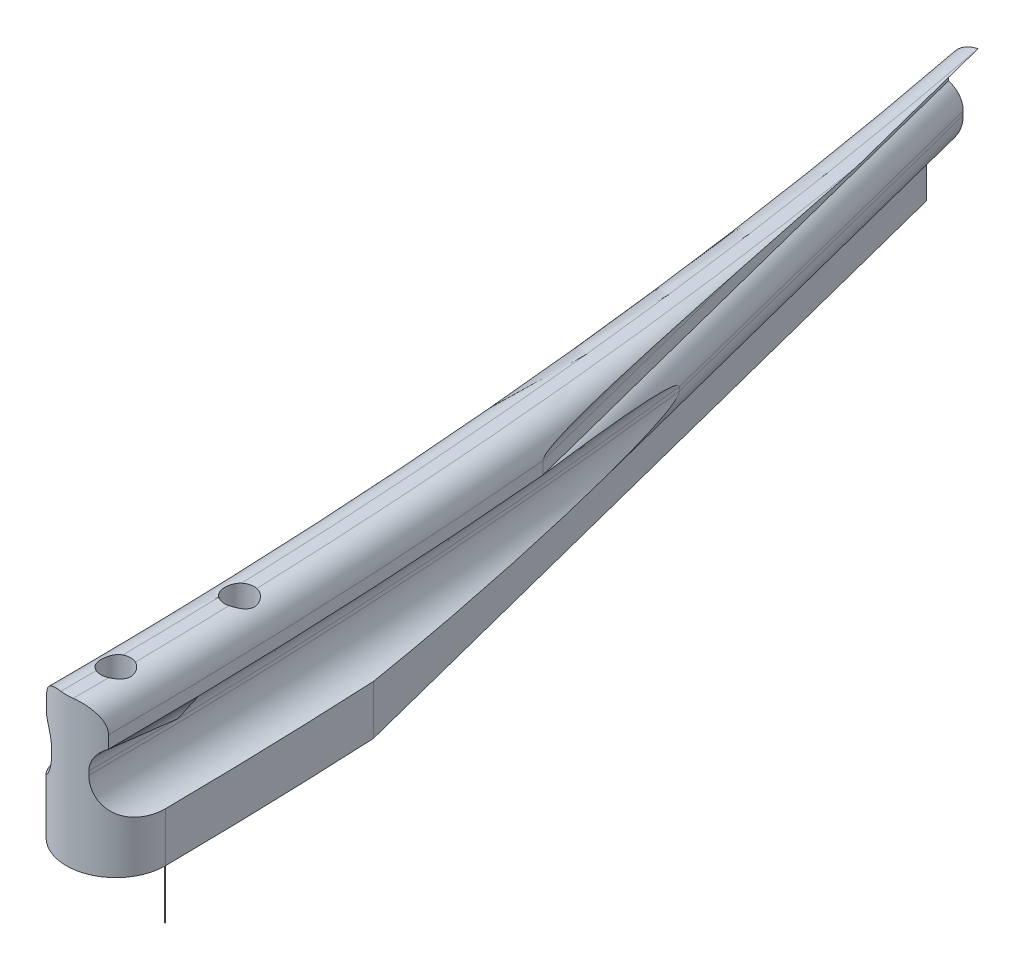
from build123d import *
from OCP.BRepAlgoAPI import BRepAlgoAPI_Cut
from OCP.TopTools import TopTools_ListOfShape

# Parameters (mm, degrees)
SKETCH_1_W                = 4
SKETCH_1_H                = 21.3823
SKETCH_1_H_2              = 8
EXTRUDE_1_DEPTH           = 4
SKETCH_1_7_W              = 44.5
SKETCH_1_7_H              = 8
EXTRUDE_2_DEPTH           = 3.5
SKETCH_2_W                = 18.5
SKETCH_2_H                = 1.5
CUT_EXTRUDE_1_DEPTH       = 38.072659107
SKETCH_2_3_W              = 2.5
SKETCH_2_3_H              = 1.5
EXTRUDE_4_DEPTH           = 29.3823
FILLET_1_R                = 1
FILLET_2_R                = 1.5
FILLET_3_R                = 1
REVOLVE_2_ANGLE           = 30
CUT_EXTRUDE_5_DEPTH       = 112.412872349
CUT_EXTRUDE_START         = -9
CUT_EXTRUDE_6_DEPTH       = 10
SKETCH_9_W                = 32.627713819
SKETCH_9_H                = 2
CUT_EXTRUDE_7_DEPTH       = 126.089275919
CUT_EXTRUDE_8_DEPTH       = 126.089275919
CUT_EXTRUDE_START_2       = -49.267691206
CUT_EXTRUDE_9_DEPTH       = 49.267691206
SKETCH_16_R               = 0.6
CUT_EXTRUDE_10_DEPTH      = 69.120571654
SKETCH_18_R               = 0.6
CUT_EXTRUDE_11_DEPTH      = 69.120571654
CUT_EXTRUDE_12_DEPTH      = 69.325780514
CUT_EXTRUDE_13_DEPTH      = 65.449078785
CUT_EXTRUDE_14_DEPTH      = 45.022808236
CUT_EXTRUDE_14_DEPTH_BACK = 45.022808236


with BuildPart() as part:
    # 草图1 → 凸台-拉伸1 (new body)
    with BuildSketch(Plane(origin=(0, 0, 0), x_dir=(1, 0, 0), z_dir=(0, 1, 0))):
        with Locations((-15.75, -4)):
            Rectangle(SKETCH_1_W, SKETCH_1_H)
        with Locations((15.75, -4)):
            Rectangle(SKETCH_1_W, SKETCH_1_H)
        with Locations((15.75, 10.69115)):
            Rectangle(SKETCH_1_W, SKETCH_1_H_2)
        with Locations((-15.75, 10.69115)):
            Rectangle(SKETCH_1_W, SKETCH_1_H_2)
    extrude(amount=EXTRUDE_1_DEPTH)

    # 草图1<7> → 凸台-拉伸2 (add)
    with BuildSketch(Plane(origin=(0, 0, 0), x_dir=(1, 0, 0), z_dir=(0, 1, 0))):
        with Locations((0, 10.69115)):
            Rectangle(SKETCH_1_7_W, SKETCH_1_7_H)
    extrude(amount=EXTRUDE_2_DEPTH)

    # 草图2 → 切除-拉伸1 (cut, through all)
    with BuildSketch(Plane(origin=(0, 0, -14.69115), x_dir=(-1, 0, 0), z_dir=(0, 0, -1))):
        with Locations((0, 2.75)):
            Rectangle(SKETCH_2_W, SKETCH_2_H)
        Polygon((13.25, 3.5), (9.25, 3.5), (9.25, 2), align=None)
        Polygon((-9.25, 3.5), (-13.25, 3.5), (-9.25, 2), align=None)
        Polygon((-22.25, 3.5), (-22.25, 2), (-18.25, 3.5), align=None)
        Polygon((22.25, 3.5), (18.25, 3.5), (22.25, 2), align=None)
    extrude(amount=-CUT_EXTRUDE_1_DEPTH, mode=Mode.SUBTRACT)

    # 草图2<3> → 凸台-拉伸4 (add, through all)
    with BuildSketch(Plane(origin=(0, 0, -14.69115), x_dir=(-1, 0, 0), z_dir=(0, 0, -1))):
        with Locations((-15.75, 7.25)):
            Rectangle(SKETCH_2_3_W, SKETCH_2_3_H)
        Polygon((-15, 6.5), (-16.5, 6.5), (-16.5, 4), (-15.75, 4), (-15, 4), align=None)
        with Locations((15.75, 7.25)):
            Rectangle(SKETCH_2_3_W, SKETCH_2_3_H)
        Polygon((16.5, 6.5), (15, 6.5), (15, 4), (15.75, 4), (16.5, 4), align=None)
    extrude(amount=-EXTRUDE_4_DEPTH)

    # 圆角1
    # the kernel refuses this fillet: 1 mm, written as the material it adds along each edge
    with BuildSketch(Plane(origin=(-16.5, 6.5, -14.69115), x_dir=(-1, 0, 0), z_dir=(0, 0, 1)), Plane(origin=(15, 6.5, -14.69115), x_dir=(-1, 0, 0), z_dir=(0, 0, 1))) as fillet_1_piece_1:
        with BuildLine():
            CenterArc((1, 0.866025404), FILLET_1_R, 180, 60)
            Line((0, 0.866025404), (-0.02, 0.866025404))
            Line((-0.02, 0.866025404), (-0.02, 0))
            Line((-0.02, 0), (0, -0.02))
            ThreePointArc((0, -0.02), (0.25, -0.02), (0.49, -0.017320508))
            Line((0.49, -0.017320508), (0.5, 0))
        make_face()
    extrude(amount=29.3823)
    with BuildSketch(Plane(origin=(-15, 6.5, -14.69115), x_dir=(0, -1, 0), z_dir=(0, 0, 1)), Plane(origin=(16.5, 6.5, -14.69115), x_dir=(0, -1, 0), z_dir=(0, 0, 1))) as fillet_1_piece_2:
        with BuildLine():
            CenterArc((0.866025404, 1), FILLET_1_R, 210, 60)
            Line((0, 0.5), (-0.017320508, 0.49))
            ThreePointArc((-0.017320508, 0.49), (-0.02, 0.25), (-0.02, 0))
            Line((-0.02, 0), (0, -0.02))
            Line((0, -0.02), (0.866025404, -0.02))
            Line((0.866025404, -0.02), (0.866025404, 0))
        make_face()
    extrude(amount=29.3823)

    # 圆角2
    # the kernel refuses this fillet: 1.5 mm, written as the material it adds along each edge
    with BuildSketch(Plane(origin=(16.5, 4, -14.69115), x_dir=(1, 0, 0), z_dir=(0, 0, 1))) as fillet_2_piece_1:
        with BuildLine():
            CenterArc((1.5, 1.479019946), FILLET_2_R, 180, 80.405931773)
            Line((0, 1.479019946), (-0.03, 1.479019946))
            Line((-0.03, 1.479019946), (-0.03, 0))
            Line((-0.03, 0), (0, -0.03))
            ThreePointArc((0, -0.03), (0.625, -0.03), (1.245, -0.029580399))
            Line((1.245, -0.029580399), (1.25, 0))
        make_face()
    extrude(amount=29.3823)
    with BuildSketch(Plane(origin=(15, 4, -14.69115), x_dir=(0, 1, 0), z_dir=(0, 0, 1)), Plane(origin=(-16.5, 4, -14.69115), x_dir=(0, 1, 0), z_dir=(0, 0, 1))) as fillet_2_piece_2:
        with BuildLine():
            CenterArc((1.479019946, 1.5), FILLET_2_R, 189.594068227, 80.405931773)
            Line((0, 1.25), (-0.029580399, 1.245))
            ThreePointArc((-0.029580399, 1.245), (-0.03, 0.625), (-0.03, 0))
            Line((-0.03, 0), (0, -0.03))
            Line((0, -0.03), (1.479019946, -0.03))
            Line((1.479019946, -0.03), (1.479019946, 0))
        make_face()
    extrude(amount=29.3823)
    with BuildSketch(Plane(origin=(-15, 4, -14.69115), x_dir=(0, 1, 0), z_dir=(0, 0, 1))) as fillet_2_piece_3:
        with BuildLine():
            CenterArc((1.479019946, -1.5), FILLET_2_R, 90, 80.405931773)
            Line((0, -1.25), (-0.029580399, -1.245))
            ThreePointArc((-0.029580399, -1.245), (-0.03, -0.625), (-0.03, 0))
            Line((-0.03, 0), (0, 0.03))
            Line((0, 0.03), (1.479019946, 0.03))
            Line((1.479019946, 0.03), (1.479019946, 0))
        make_face()
    extrude(amount=29.3823)

    # 圆角3
    fillet_3_edges = [part.edges().sort_by_distance(p)[0] for p in [
        (14.5, 8, 0),
        (17, 8, 0),
        (-17, 8, 0),
        (-14.5, 8, 0),
    ]]
    fillet(fillet_3_edges, radius=FILLET_3_R)

    # 草图7 → 旋转2 (revolve)
    with BuildSketch(Plane(origin=(0, 0, -14.69115), x_dir=(-1, 0, 0), z_dir=(0, 0, -1))):
        with BuildLine():
            Line((-17.75, 4), (-17.75, 3.5))
            Line((-17.75, 3.5), (-17.75, 0))
            Line((-17.75, 0), (-13.75, 0))
            Line((-13.75, 0), (-13.75, 3.5))
            Line((-13.75, 3.5), (-13.75, 4))
            ThreePointArc((-13.75, 4), (-14.645643924, 4.510774109), (-15, 5.479019946))
            Line((-15, 5.479019946), (-15, 5.633974596))
            ThreePointArc((-15, 5.633974596), (-14.866025404, 6.133974596), (-14.5, 6.5))
            Line((-14.5, 6.5), (-14.5, 7))
            ThreePointArc((-14.5, 7), (-14.792893219, 7.707106781), (-15.5, 8))
            Line((-15.5, 8), (-16, 8))
            ThreePointArc((-16, 8), (-16.707106781, 7.707106781), (-17, 7))
            Line((-17, 7), (-17, 6.5))
            ThreePointArc((-17, 6.5), (-16.633974596, 6.133974596), (-16.5, 5.633974596))
            Line((-16.5, 5.633974596), (-16.5, 5.479019946))
            ThreePointArc((-16.5, 5.479019946), (-16.854356076, 4.510774109), (-17.75, 4))
        make_face()
    revolve(axis=Axis((-200, 10, -14.69115), (0, 1, 0)), revolution_arc=REVOLVE_2_ANGLE)

    # 草图5 → 切除-拉伸5 (cut, through all)
    with BuildSketch(Plane(origin=(0, 0, -14.69115), x_dir=(-1, 0, 0), z_dir=(0, 0, -1))):
        with BuildLine():
            Line((17, 6.5), (17, 7))
            ThreePointArc((17, 7), (16.707106781, 7.707106781), (16, 8))
            Line((16, 8), (15.5, 8))
            ThreePointArc((15.5, 8), (14.792893219, 7.707106781), (14.5, 7))
            Line((14.5, 7), (14.5, 6.5))
            ThreePointArc((14.5, 6.5), (14.866025404, 6.133974596), (15, 5.633974596))
            Line((15, 5.633974596), (15, 5.479019946))
            ThreePointArc((15, 5.479019946), (14.645643924, 4.510774109), (13.75, 4))
            Line((13.75, 4), (13.75, 3.5))
            Line((13.75, 3.5), (13.25, 3.5))
            Line((13.25, 3.5), (9.25, 2))
            Line((9.25, 2), (-9.25, 2))
            Line((-9.25, 2), (-13.25, 3.5))
            Line((-13.25, 3.5), (-13.75, 3.5))
            Line((-13.75, 3.5), (-13.75, 4))
            ThreePointArc((-13.75, 4), (-14.645643924, 4.510774109), (-15, 5.479019946))
            Line((-15, 5.479019946), (-15, 5.633974596))
            ThreePointArc((-15, 5.633974596), (-14.866025404, 6.133974596), (-14.5, 6.5))
            Line((-14.5, 6.5), (-14.5, 7))
            ThreePointArc((-14.5, 7), (-14.792893219, 7.707106781), (-15.5, 8))
            Line((-15.5, 8), (-16, 8))
            ThreePointArc((-16, 8), (-16.707106781, 7.707106781), (-17, 7))
            Line((-17, 7), (-17, 6.5))
            ThreePointArc((-17, 6.5), (-16.633974596, 6.133974596), (-16.5, 5.633974596))
            Line((-16.5, 5.633974596), (-16.5, 5.479019946))
            ThreePointArc((-16.5, 5.479019946), (-16.854356076, 4.510774109), (-17.75, 4))
            Line((-17.75, 4), (-17.75, 3.5))
            Line((-17.75, 3.5), (-18.25, 3.5))
            Line((-18.25, 3.5), (-22.25, 2))
            Line((-22.25, 2), (-22.25, 0))
            Line((-22.25, 0), (22.25, 0))
            Line((22.25, 0), (22.25, 2))
            Line((22.25, 2), (18.25, 3.5))
            Line((18.25, 3.5), (17.75, 3.5))
            Line((17.75, 3.5), (17.75, 4))
            ThreePointArc((17.75, 4), (16.854356076, 4.510774109), (16.5, 5.479019946))
            Line((16.5, 5.479019946), (16.5, 5.633974596))
            ThreePointArc((16.5, 5.633974596), (16.633974596, 6.133974596), (17, 6.5))
        make_face()
    extrude(amount=-CUT_EXTRUDE_5_DEPTH, mode=Mode.SUBTRACT)

    # 切除-拉伸6: read off the stored shape, not the designer's step
    # 切除-拉伸6 outline → 切除-拉伸6 (cut)
    with BuildSketch(Plane.XZ.offset(CUT_EXTRUDE_START)):
        with BuildLine():
            Line((15.740729812, -14.69115), (13.75, -14.69115))
            ThreePointArc((13.75, -14.69115), (13.747703924, -15.681890654), (13.740815747, -16.672610023))
            ThreePointArc((13.740815747, -16.672610023), (14.333086384, -15.270396687), (15.740729812, -14.69115))
        make_face()
        with BuildLine():
            ThreePointArc((17.740643878, -16.709689977), (17.747660957, -15.70043083), (17.75, -14.69115))
            Line((17.75, -14.69115), (15.740729812, -14.69115))
            ThreePointArc((15.740729812, -14.69115), (17.161483126, -15.283506571), (17.740643878, -16.709689977))
        make_face()
    extrude(amount=CUT_EXTRUDE_6_DEPTH, mode=Mode.SUBTRACT)

    # 草图9 → 切除-拉伸7 (cut, through all)
    with BuildSketch(Plane.XY):
        with Locations((1.426786968, 1)):
            Rectangle(SKETCH_9_W, SKETCH_9_H)
    extrude(amount=-CUT_EXTRUDE_7_DEPTH, mode=Mode.SUBTRACT)

    # 草图13 → 切除-拉伸8 (cut, through all)
    with BuildSketch(Plane(origin=(0, 8, 0), x_dir=(1, 0, 0), z_dir=(0, 1, 0))):
        Polygon((16.010534911, 67.272147588), (-7.329315732, 60.975271536), (-25.509234379, 137.795453838), (-4.693944012, 144.014875523), align=None)
    extrude(amount=-CUT_EXTRUDE_8_DEPTH, mode=Mode.SUBTRACT)


with BuildPart() as cut_extrude_9_tool:
    # 切除-拉伸9: read off the stored shape, not the designer's step
    # 切除-拉伸9 outline → 切除-拉伸9 (new body)
    with BuildSketch(Plane(origin=(-15.831701273, 0, -58.681406476), x_dir=(-0.9654799025758982, 0, 0.26047755704097475), z_dir=(-0.2604775570409747, 0, -0.9654799025758981)).offset(CUT_EXTRUDE_START_2)):
        with BuildLine():
            add(Edge.make_bspline(
                [(-26.160537299, 7.999998424), (-26.121993875, 7.999997186), (-26.08345031, 7.997770563), (-25.989275294, 7.986839423), (-25.933934895, 7.975627276), (-25.825922284, 7.944070731), (-25.773250062, 7.923726363), (-25.672071361, 7.874483013), (-25.623564731, 7.845584343), (-25.532095564, 7.780052945), (-25.489132751, 7.743420606), (-25.409984814, 7.66347655), (-25.373797132, 7.620167366), (-25.309197596, 7.528069909), (-25.280788196, 7.479279913), (-25.232562577, 7.377616897), (-25.212748824, 7.324742709), (-25.182312299, 7.216458966), (-25.171675504, 7.161053415), (-25.163907361, 7.087699297), (-25.162517019, 7.07013274), (-25.160671327, 7.035046347), (-25.160210933, 7.017526777), (-25.160209944, 7)],
                knots=[1.569539872, 1.569539872, 1.569539872, 1.569539872, 1.685033124, 1.685033124, 1.853625994, 1.853625994, 2.022218312, 2.022218312, 2.190804502, 2.190804502, 2.35938225, 2.35938225, 2.527896204, 2.527896204, 2.696463261, 2.696463261, 2.865078641, 2.865078641, 3.033435924, 3.033435924, 3.086283215, 3.086283215, 3.138843098, 3.138843098, 3.138843098, 3.138843098], degree=3))
            Line((-26.160537299, 7.999998424), (-26.660699845, 7.999998424))
            add(Edge.make_bspline(
                [(-27.661022687, 7), (-27.661022504, 7.028060696), (-27.659840464, 7.056108011), (-27.655119198, 7.112069239), (-27.651574493, 7.13998269), (-27.637429693, 7.223075643), (-27.623318842, 7.277699168), (-27.586127728, 7.383799255), (-27.563043332, 7.435274354), (-27.508564404, 7.533616697), (-27.477171485, 7.580484832), (-27.40696018, 7.668293154), (-27.368140579, 7.709232369), (-27.284175022, 7.784021722), (-27.239028096, 7.817870771), (-27.143681646, 7.877519888), (-27.09348081, 7.903317859), (-26.989464676, 7.946120801), (-26.935649604, 7.963126319), (-26.825911939, 7.987869077), (-26.769988702, 7.995603462), (-26.696125362, 7.999529581), (-26.678412618, 7.999998993), (-26.660699845, 7.999998424)],
                knots=[0.000199877, 0.000199877, 0.000199877, 0.000199877, 0.084330442, 0.084330442, 0.168656793, 0.168656793, 0.337038708, 0.337038708, 0.505498265, 0.505498265, 0.673925161, 0.673925161, 0.842379637, 0.842379637, 1.010859962, 1.010859962, 1.179384125, 1.179384125, 1.347897796, 1.347897796, 1.516463342, 1.516463342, 1.569538693, 1.569538693, 1.569538693, 1.569538693], degree=3))
            Line((-27.661022687, 7), (-27.661022693, 6.499999993))
            add(Edge.make_bspline(
                [(-27.16086164, 5.633974596), (-27.160861719, 5.662050942), (-27.162045141, 5.690114022), (-27.166771795, 5.746106343), (-27.170320501, 5.774035122), (-27.1844702, 5.857111045), (-27.198574914, 5.911702521), (-27.235753479, 6.017762657), (-27.258834489, 6.069228786), (-27.313302438, 6.167567636), (-27.344691408, 6.214439228), (-27.418624307, 6.306887494), (-27.461993001, 6.351812519), (-27.532718296, 6.412602472), (-27.557291177, 6.431796511), (-27.608009033, 6.467733873), (-27.634146776, 6.4844874), (-27.661022693, 6.499999993)],
                knots=[0.000199878, 0.000199878, 0.000199878, 0.000199878, 0.084377582, 0.084377582, 0.168750756, 0.168750756, 0.337038792, 0.337038792, 0.505461316, 0.505461316, 0.673925056, 0.673925056, 0.860061179, 0.860061179, 0.953486913, 0.953486913, 1.046510009, 1.046510009, 1.046510009, 1.046510009], degree=3))
            Line((-27.16086164, 5.633974596), (-27.160861604, 5.479019946))
            add(Edge.make_bspline(
                [(-28.411262876, 4.000000008), (-28.370029739, 4.006967758), (-28.329107236, 4.015655942), (-28.247742777, 4.036513194), (-28.207309134, 4.048714692), (-28.08783509, 4.090355468), (-28.01049231, 4.124852896), (-27.862697557, 4.206343779), (-27.792249049, 4.253343477), (-27.660255752, 4.358494936), (-27.598708182, 4.416643203), (-27.486273953, 4.542424711), (-27.435383523, 4.610054584), (-27.345650214, 4.752947949), (-27.306815033, 4.82821628), (-27.242326505, 4.984230444), (-27.216679212, 5.064978773), (-27.179372025, 5.229507916), (-27.167681742, 5.313281729), (-27.161600474, 5.424556515), (-27.160856812, 5.45179501), (-27.160861604, 5.479019946)],
                knots=[0.001202493, 0.001202493, 0.001202493, 0.001202493, 0.126579738, 0.126579738, 0.253153562, 0.253153562, 0.505912912, 0.505912912, 0.758798687, 0.758798687, 1.011605313, 1.011605313, 1.264322315, 1.264322315, 1.517200369, 1.517200369, 1.770194383, 1.770194383, 2.022636532, 2.022636532, 2.104337931, 2.104337931, 2.104337931, 2.104337931], degree=3))
            Line((-28.411262876, 4.000000008), (-28.411262874, 2))
            Line((-28.411262874, 2), (-24.409962397, 2))
            Line((-24.409962397, 2), (-24.409962432, 3.999999793))
            add(Edge.make_bspline(
                [(-25.660373995, 5.479019946), (-25.660373719, 5.436896809), (-25.658597943, 5.394793793), (-25.651508031, 5.310821743), (-25.64618847, 5.268953166), (-25.62496338, 5.144314582), (-25.60379133, 5.062378933), (-25.547992013, 4.903226755), (-25.513358134, 4.826012566), (-25.431628729, 4.678505956), (-25.384537026, 4.608211422), (-25.279228051, 4.476526079), (-25.221010995, 4.415135097), (-25.09505817, 4.302954312), (-25.027316357, 4.25217129), (-24.88420556, 4.16264898), (-24.808828423, 4.123922751), (-24.652758935, 4.059753969), (-24.572078475, 4.03428277), (-24.463411816, 4.009776554), (-24.436742509, 4.004520241), (-24.409962432, 3.999999793)],
                knots=[0.000199877, 0.000199877, 0.000199877, 0.000199877, 0.126491847, 0.126491847, 0.252977568, 0.252977568, 0.505555719, 0.505555719, 0.758258082, 0.758258082, 1.010883018, 1.010883018, 1.26350304, 1.26350304, 1.5162841, 1.5162841, 1.769337996, 1.769337996, 2.021842694, 2.021842694, 2.103344969, 2.103344969, 2.103344969, 2.103344969], degree=3))
            Line((-25.660373995, 5.479019946), (-25.660373993, 5.633974596))
            add(Edge.make_bspline(
                [(-25.160209932, 6.499999999), (-25.184478281, 6.485993166), (-25.208146504, 6.470972866), (-25.254248925, 6.438925903), (-25.276676785, 6.421890121), (-25.341595174, 6.368101172), (-25.381853024, 6.3285898), (-25.455178844, 6.243354254), (-25.488240954, 6.197625066), (-25.546228596, 6.101264036), (-25.571152285, 6.050631086), (-25.614267852, 5.940412104), (-25.631494656, 5.880441993), (-25.648794147, 5.788871232), (-25.653137268, 5.75801754), (-25.65892374, 5.696106747), (-25.660373351, 5.66505023), (-25.660373993, 5.633974596)],
                knots=[0.000399994, 0.000399994, 0.000399994, 0.000399994, 0.084410261, 0.084410261, 0.16881631, 0.16881631, 0.337175076, 0.337175076, 0.505670414, 0.505670414, 0.674203874, 0.674203874, 0.860199571, 0.860199571, 0.953556827, 0.953556827, 1.046711929, 1.046711929, 1.046711929, 1.046711929], degree=3))
            Line((-25.160209932, 6.499999999), (-25.160209944, 7))
        make_face()
    extrude(amount=CUT_EXTRUDE_9_DEPTH)


with BuildPart() as part_1:
    add(part.part)

    # 切除-拉伸9: cut by cut_extrude_9_tool, with a tolerance
    cut_extrude_9_stock = TopTools_ListOfShape()
    cut_extrude_9_stock.Append(part_1.part.wrapped)
    cut_extrude_9_tools = TopTools_ListOfShape()
    cut_extrude_9_tools.Append(cut_extrude_9_tool.part.wrapped)
    cut_extrude_9_cut = BRepAlgoAPI_Cut()
    cut_extrude_9_cut.SetArguments(cut_extrude_9_stock)
    cut_extrude_9_cut.SetTools(cut_extrude_9_tools)
    cut_extrude_9_cut.SetFuzzyValue(0.00001)
    cut_extrude_9_cut.Build()
    add(Compound.cast(cut_extrude_9_cut.Shape()).solids(), mode=Mode.REPLACE)

    # 草图16 → 切除-拉伸10 (cut, through all)
    with BuildSketch(Plane(origin=(0, 2, 0), x_dir=(-1, 0, 0), z_dir=(0, -1, 0))):
        with Locations(Location((-15.740729812, 16.69115, 0), (0, 0, 90))):
            Circle(SKETCH_16_R)
    extrude(amount=-CUT_EXTRUDE_10_DEPTH, mode=Mode.SUBTRACT)

    # 草图18 → 切除-拉伸11 (cut, through all)
    with BuildSketch(Plane(origin=(0, 2, 0), x_dir=(-1, 0, 0), z_dir=(0, -1, 0))):
        with Locations(Location((-15.750072705, 21.69115, 0), (0, 0, 90))):
            Circle(SKETCH_18_R)
    extrude(amount=-CUT_EXTRUDE_11_DEPTH, mode=Mode.SUBTRACT)

    # 草图19 → 切除-拉伸12 (cut, through all)
    with BuildSketch(Plane(origin=(0, 8, 0), x_dir=(1, 0, 0), z_dir=(0, 1, 0))):
        Polygon((9.42577173, 65.495639323), (10.519777469, 61.440623732), (7.474418334, 60.619013975), (6.380412595, 64.674029566), align=None)
    extrude(amount=-CUT_EXTRUDE_12_DEPTH, mode=Mode.SUBTRACT)

    # 草图20 → 切除-拉伸13 (cut, through all)
    with BuildSketch(Plane(origin=(0, 8, 0), x_dir=(1, 0, 0), z_dir=(0, 1, 0))):
        Polygon((5.321922206, 54.282572393), (14.884942443, 56.718718169), (11.824728013, 71.430358659), (2.577892141, 69.094191063), align=None)
    extrude(amount=-CUT_EXTRUDE_13_DEPTH, mode=Mode.SUBTRACT)

    # 草图12 → 切除-拉伸14 (cut, two sides: drawn at the far end of the back side and taken through both)
    with BuildSketch(Plane(origin=(-4.6452924, 0, -51.743459523), x_dir=(0.9690505868068372, 0, -0.24686222920755765), z_dir=(0.24686222920755765, 0, 0.9690505868068372)).offset(-CUT_EXTRUDE_14_DEPTH_BACK)):
        with BuildLine():
            Line((14.939240455, 4), (14.939240455, 0))
            Line((14.939240455, 0), (18.939240455, 0))
            Line((18.939240455, 0), (18.939240455, 4))
            ThreePointArc((18.939240455, 4), (18.043596532, 4.510774109), (17.689240455, 5.479019946))
            Line((17.689240455, 5.479019946), (17.689240455, 5.633974596))
            ThreePointArc((17.689240455, 5.633974596), (17.823215052, 6.133974596), (18.189240455, 6.5))
            Line((18.189240455, 6.5), (18.189240455, 7))
            ThreePointArc((18.189240455, 7), (17.896347236, 7.707106781), (17.189240455, 8))
            Line((17.189240455, 8), (16.689240455, 8))
            ThreePointArc((16.689240455, 8), (15.982133674, 7.707106781), (15.689240455, 7))
            Line((15.689240455, 7), (15.689240455, 6.5))
            ThreePointArc((15.689240455, 6.5), (16.055265859, 6.133974596), (16.189240455, 5.633974596))
            Line((16.189240455, 5.633974596), (16.189240455, 5.479019946))
            ThreePointArc((16.189240455, 5.479019946), (15.834884379, 4.510774109), (14.939240455, 4))
        make_face()
    extrude(amount=CUT_EXTRUDE_14_DEPTH + CUT_EXTRUDE_14_DEPTH_BACK, mode=Mode.SUBTRACT)


solid = part_1.part
